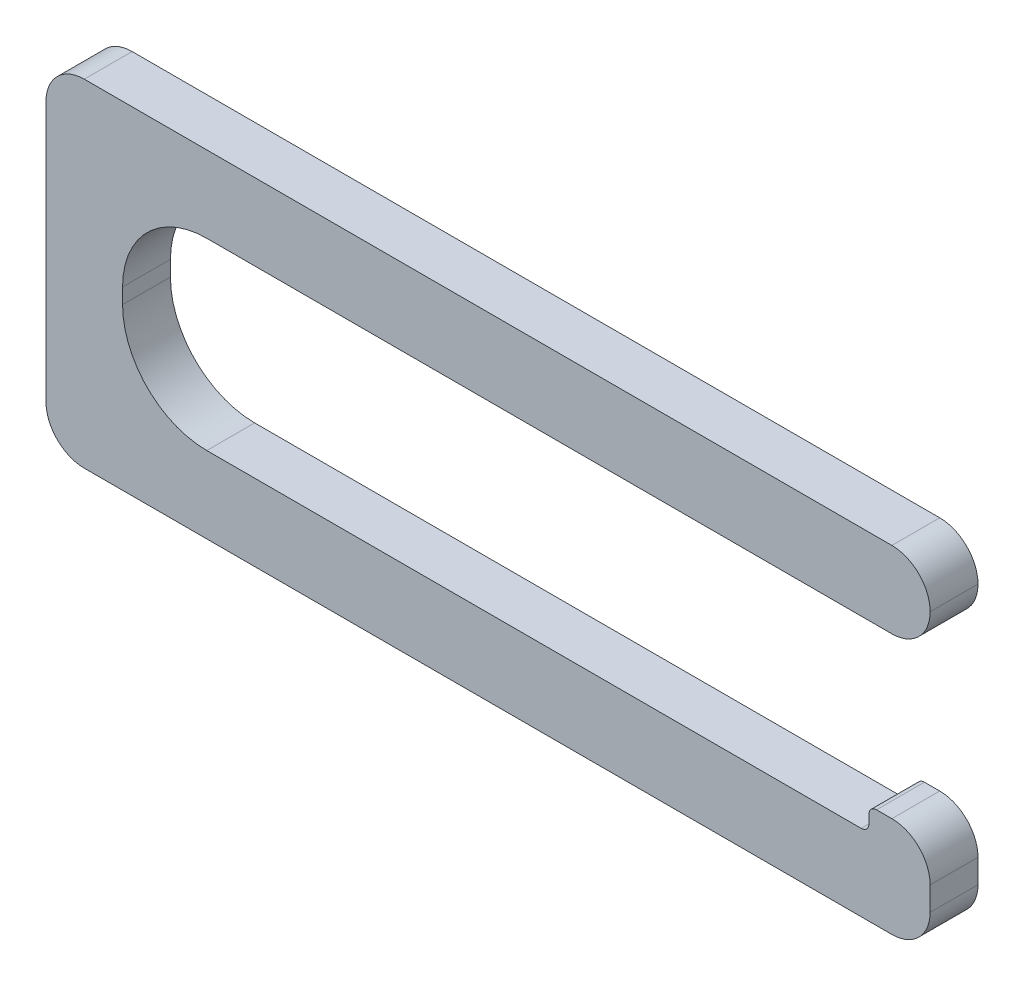
from build123d import *

# Parameters (mm, degrees)
BOSS_EXTRUDE1_DEPTH = 1.5875
FILLET1_R           = 1.27
FILLET2_R           = 0.254
FILLET3_R           = 2.794


with BuildPart() as part:
    # Sketch1 → Boss-Extrude1 (new body)
    with BuildSketch(Plane.XY):
        Polygon((5.651886258, 2.848562209), (34.979186258, 2.848562209), (34.979186258, 6.175962209), (32.947186258, 6.175962209), (32.947186258, 5.388562209), (8.191886258, 5.388562209), (8.191886258, 11.484562209), (34.979186258, 11.484562209), (34.979186258, 14.024562209), (5.651886258, 14.024562209), align=None)
    extrude(amount=BOSS_EXTRUDE1_DEPTH)

    # Fillet1
    fillet1_edges = [part.edges().sort_by_distance(p)[0] for p in [
        (5.651886258, 14.024562209, 0.79375),
        (34.979186258, 14.024562209, 0.79375),
        (34.979186258, 11.484562209, 0.79375),
        (34.979186258, 6.175962209, 0.79375),
        (34.979186258, 2.848562209, 0.79375),
        (5.651886258, 2.848562209, 0.79375),
    ]]
    fillet(fillet1_edges, radius=FILLET1_R - 0.0001)  # a hair under: the kernel refuses the full size

    # Fillet2
    fillet2_edges = [part.edges().sort_by_distance(p)[0] for p in [
        (32.947186258, 5.388562209, 0.79375),
        (32.947186258, 6.175962209, 0.79375),
    ]]
    fillet(fillet2_edges, radius=FILLET2_R)

    # Fillet3
    fillet3_edges = [part.edges().sort_by_distance(p)[0] for p in [
        (8.191886258, 11.484562209, 0.79375),
        (8.191886258, 5.388562209, 0.79375),
    ]]
    fillet(fillet3_edges, radius=FILLET3_R)


solid = part.part
